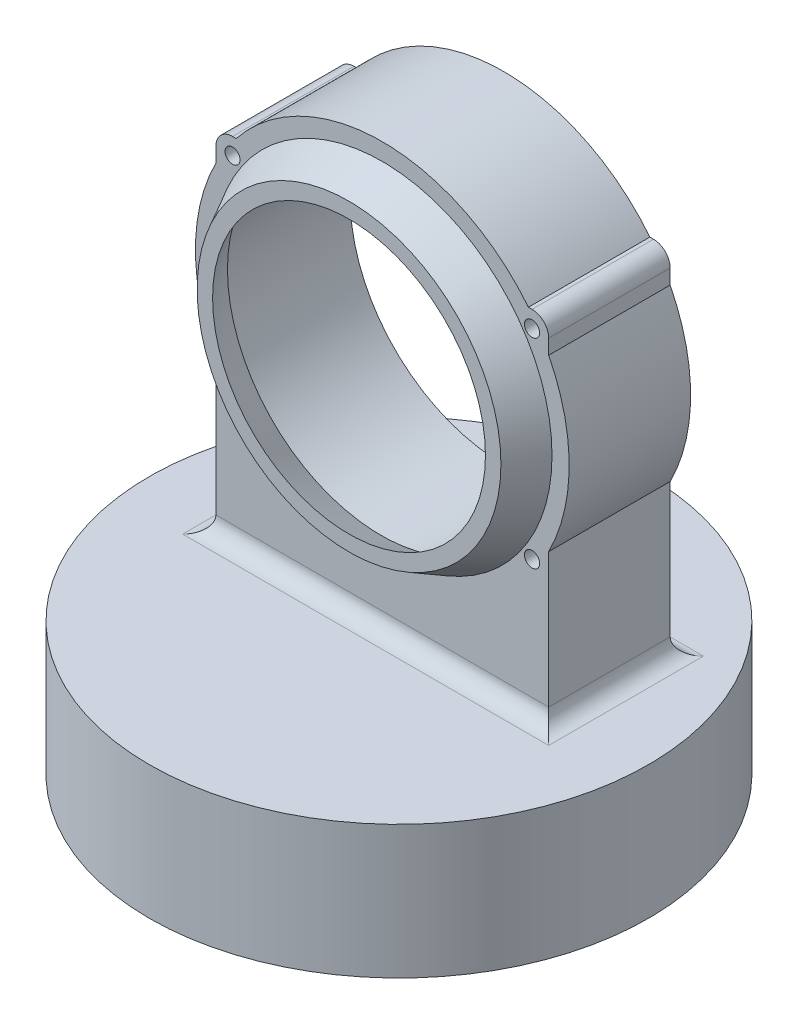
from build123d import *

# Parameters (mm, degrees)
CROQUIS1_R              = 75
SALIENTE_EXTRUIR1_DEPTH = 40
SALIENTE_EXTRUIR2_START = 5
CROQUIS3_R              = 46.15
SALIENTE_EXTRUIR2_DEPTH = 36.5
CROQUIS5_R              = 51
CROQUIS5_R_2            = 41
SALIENTE_EXTRUIR3_DEPTH = 10
CHAFL_N1_SIZE           = 5.350722602
CHAFL_N1_SIZE_2         = 10
CHAFL_N2_SIZE2          = 10
CHAFL_N2_SIZE           = 5.350722602
REDONDEO1_R             = 5
CROQUIS7_R              = 2.248271999
CROQUIS7_R_2            = 2.28310755
CORTAR_EXTRUIR2_DEPTH   = 212.91154603
CROQUIS8_R              = 61.227064255
CORTAR_EXTRUIR3_DEPTH   = 1.5
CROQUIS8_3_R            = 2.5
CORTAR_EXTRUIR4_DEPTH   = 10


# Some blends are built 0.0001 mm under size
with BuildPart() as part:
    # Croquis1 → Saliente-Extruir1 (new body)
    with BuildSketch(Plane(origin=(0, 0, 0), x_dir=(1, 0, 0), z_dir=(0, 1, 0))):
        with Locations(Location((0, 0, 0), (0, 0, 270))):
            Circle(CROQUIS1_R)
    extrude(amount=SALIENTE_EXTRUIR1_DEPTH)

    # Croquis3 → Saliente-Extruir2 (add)
    with BuildSketch(Plane.XY.offset(SALIENTE_EXTRUIR2_START)):
        with BuildLine():
            Line((45, 146.000391386), (43.906975528, 146.000391386))
            ThreePointArc((43.906975528, 146.000391386), (0, 167.150391386), (-43.906975528, 146.000391386))
            Line((-43.906975528, 146.000391386), (-45, 146.000391386))
            ThreePointArc((-45, 146.000391386), (-48.535533906, 144.535925292), (-50, 141.000391386))
            Line((-50, 141.000391386), (-50, 136.550782773))
            ThreePointArc((-50, 136.550782773), (-56.15, 111.000391386), (-50, 85.45))
            Line((-50, 85.45), (-50, 40))
            Line((-50, 40), (50, 40))
            Line((50, 40), (50, 85.45))
            ThreePointArc((50, 85.45), (56.15, 111.000391386), (50, 136.550782773))
            Line((50, 136.550782773), (50, 141.000391386))
            ThreePointArc((50, 141.000391386), (48.535533906, 144.535925292), (45, 146.000391386))
        make_face()
        with Locations((0, 111.000391386)):
            Circle(CROQUIS3_R, mode=Mode.SUBTRACT)
    extrude(amount=-SALIENTE_EXTRUIR2_DEPTH)

    # Croquis5 → Saliente-Extruir3 (add)
    with BuildSketch(Plane.XY.offset(5)):
        with Locations((0, 111.000391386)):
            Circle(CROQUIS5_R)
        with Locations((0, 111.000391386)):
            Circle(CROQUIS5_R_2, mode=Mode.SUBTRACT)
    extrude(amount=SALIENTE_EXTRUIR3_DEPTH)

    # Chaflán1
    # the kernel refuses this chamfer: 10, 5.350722602 mm, written as the material it takes off along each edge
    with BuildSketch(Plane(origin=(0, 111.000391386, 5), x_dir=(1, 0, 0), z_dir=(0, -1, 0))) as chafl_n1_piece_1_section:
        Polygon((41 + CHAFL_N1_SIZE, 0), (41, CHAFL_N1_SIZE_2), (41, 0), align=None)
    chafl_n1_piece_1 = revolve(axis=Axis((0, 111.000391386, 5), (0, 0, 1)), mode=Mode.PRIVATE)
    chafl_n1_piece_1 = chafl_n1_piece_1 & Plane(origin=(0, 111.000391386, 10.096546519), x_dir=(1, 0, 0), z_dir=(0, 0, 1)) * Cylinder(46.15, 186, mode=Mode.PRIVATE)
    add(chafl_n1_piece_1, mode=Mode.SUBTRACT)

    # Chaflán2
    chafl_n2_edges = [part.edges().sort_by_distance(p)[0] for p in [
        (-51, 111.000391386, 15),
    ]]
    chafl_n2_side = [part.faces().sort_by_distance(p)[0] for p in [
        (-50.892985548, 111.000391386, 15),
    ]]
    chamfer(chafl_n2_edges, length=CHAFL_N2_SIZE - 0.0001, length2=CHAFL_N2_SIZE2 - 0.0001, reference=chafl_n2_side[0])  # a hair under: the kernel refuses the full size

    # Redondeo1
    redondeo1_edges = [part.edges().sort_by_distance(p)[0] for p in [
        (0, 40, 5),
        (0, 40, -31.5),
        (50, 40, -13.25),
        (-50, 40, -13.25),
    ]]
    fillet(redondeo1_edges, radius=REDONDEO1_R)

    # Croquis7 → Cortar-Extruir2 (cut, through all)
    with BuildSketch(Plane(origin=(0, 0, -31.5), x_dir=(-1, 0, 0), z_dir=(0, 0, -1))):
        with Locations((45, 141.000391386)):
            Circle(CROQUIS7_R)
        with Locations((-45.000000475, 141.000390201)):
            Circle(CROQUIS7_R_2)
        with Locations(Location((-45.000000475, 80.973259529, 0), (0, 0, 180))):
            Circle(CROQUIS7_R_2)
        with Locations(Location((45, 80.973258343, 0), (0, 0, 180))):
            Circle(CROQUIS7_R)
    extrude(amount=-CORTAR_EXTRUIR2_DEPTH, mode=Mode.SUBTRACT)

    # Croquis8 → Cortar-Extruir3 (cut)
    with BuildSketch(Plane.XZ):
        with Locations(Location((0, 0, 0), (0, 0, 270))):
            Circle(CROQUIS8_R)
    extrude(amount=-CORTAR_EXTRUIR3_DEPTH, mode=Mode.SUBTRACT)

    # Croquis8<3> → Cortar-Extruir4 (cut)
    with BuildSketch(Plane.XZ):
        with Locations(Location((-2.647399238, 28.274392606, 0), (0, 0, 270))):
            Circle(CROQUIS8_3_R)
        with Locations(Location((24.207953628, -14.846716173, 0), (0, 0, 270))):
            Circle(CROQUIS8_3_R)
        with Locations(Location((2.647399238, -28.274392607, 0), (0, 0, 270))):
            Circle(CROQUIS8_3_R)
        with Locations(Location((-24.207953628, 14.846716173, 0), (0, 0, 270))):
            Circle(CROQUIS8_3_R)
    extrude(amount=-CORTAR_EXTRUIR4_DEPTH, mode=Mode.SUBTRACT)


solid = part.part
